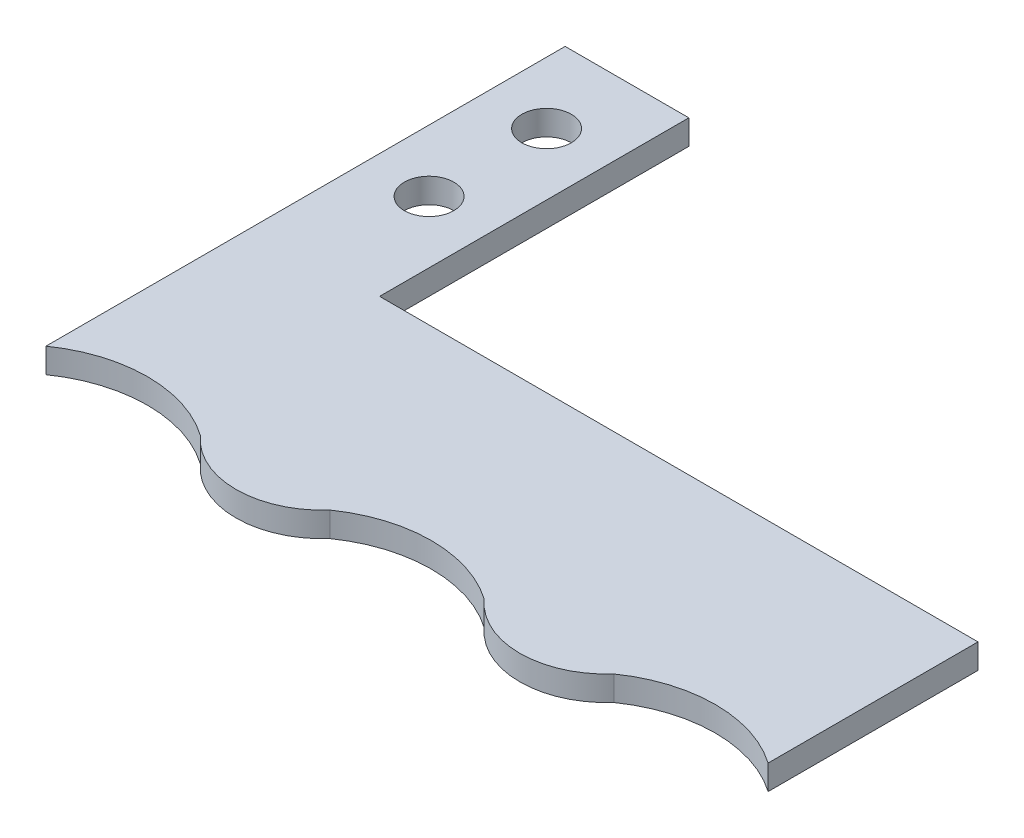
from build123d import *

# Parameters (mm, degrees)
BASE_FLANGE1_DEPTH = 2
SKETCH8_R          = 2
CUT_EXTRUDE1_DEPTH = 2


# Sheet-metal steps are written as plain solids
with BuildPart() as part:
    # Sketch3 → Base-Flange1 (new body)
    with BuildSketch(Plane(origin=(0, 0, 0), x_dir=(1, 0, 0), z_dir=(0, 1, 0))):
        with BuildLine():
            Line((-29.187643745, 8.908278482), (-29.187643745, 25.875))
            Line((-29.187643745, 25.875), (-29.187643745, 50.875))
            Line((-29.187643745, 50.875), (-19.187643745, 50.875))
            Line((-19.187643745, 50.875), (-19.187643745, 25.875))
            Line((-19.187643745, 25.875), (29.187643745, 25.875))
            Line((29.187643745, 25.875), (29.187643745, 8.908278482))
            ThreePointArc((29.187643745, 8.908278482), (22.95, 10.875), (16.712356255, 8.908278482))
            ThreePointArc((16.712356255, 8.908278482), (11.475, 6.552640597), (6.237643745, 8.908278482))
            ThreePointArc((6.237643745, 8.908278482), (0, 10.875), (-6.237643745, 8.908278482))
            ThreePointArc((-6.237643745, 8.908278482), (-11.475, 6.552640597), (-16.712356255, 8.908278482))
            ThreePointArc((-16.712356255, 8.908278482), (-22.95, 10.875), (-29.187643745, 8.908278482))
        make_face()
    extrude(amount=-BASE_FLANGE1_DEPTH)

    # Sketch8 → Cut-Extrude1 (cut)
    with BuildSketch(Plane(origin=(0, 0, 0), x_dir=(1, 0, 0), z_dir=(0, 1, 0))):
        with Locations(Location((-24.187643745, 44.375, 0), (0, 0, 270))):
            Circle(SKETCH8_R)
        with Locations(Location((-24.187643745, 34.875, 0), (0, 0, 270))):
            Circle(SKETCH8_R)
    extrude(amount=-CUT_EXTRUDE1_DEPTH, mode=Mode.SUBTRACT)


solid = part.part
